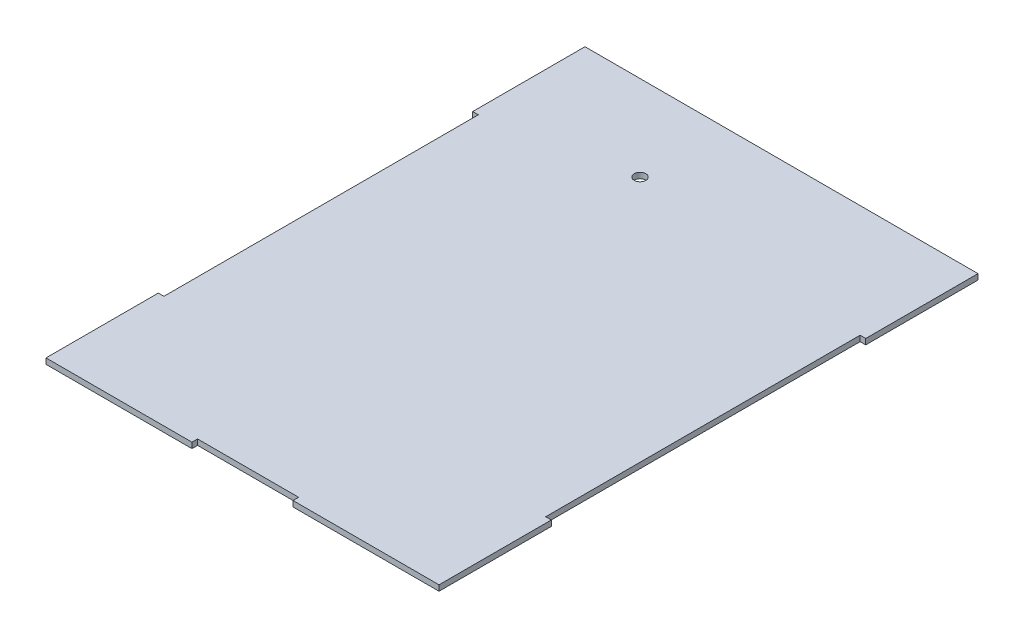
from build123d import *

# Parameters (mm, degrees)
SKETCH1_W                = 457.2
SKETCH1_H                = 609.6
BOSS_EXTRUDE1_DEPTH      = 6.35
CUT_EXTRUDE4_DEPTH       = 763.026457874
CUT_EXTRUDE4_DEPTH_BACK  = 763.026457874
SKETCH3_W                = 12.7
SKETCH3_H                = 355.6
CUT_EXTRUDE5_DEPTH       = 763.026457874
CUT_EXTRUDE5_DEPTH_BACK  = 763.026457874
CUT_EXTRUDE7_DEPTH       = 763.026457874
CUT_EXTRUDE7_DEPTH_BACK  = 763.026457874
SKETCH7_W                = 6.35
SKETCH7_H                = 127
CUT_EXTRUDE8_DEPTH       = 763.026457874
CUT_EXTRUDE8_DEPTH_BACK  = 763.026457874
CUT_EXTRUDE10_START      = -6.35
CUT_EXTRUDE10_OUTLINE_W  = 6.35
CUT_EXTRUDE10_OUTLINE_H  = 127
CUT_EXTRUDE10_DEPTH      = 6.35
CUT_EXTRUDE11_DEPTH      = 763.026457874
CUT_EXTRUDE11_DEPTH_BACK = 763.026457874
CUT_EXTRUDE12_DEPTH      = 759.233608461
CUT_EXTRUDE12_DEPTH_BACK = 759.233608461
SKETCH2_R                = 6.604
CUT_EXTRUDE13_DEPTH      = 759.233608461


# Read off the part's stored shape, not the designer's step: Cut-Extrude10
with BuildPart() as part:
    # Sketch1 → Boss-Extrude1 (new body)
    with BuildSketch(Plane(origin=(0, 0, 0), x_dir=(1, 0, 0), z_dir=(0, 1, 0))):
        with Locations((-228.6, 304.8)):
            Rectangle(SKETCH1_W, SKETCH1_H)
    extrude(amount=BOSS_EXTRUDE1_DEPTH)

    # Sketch3 → Cut-Extrude4 (cut, two sides: drawn at the far end of the back side and taken through both)
    with BuildSketch(Plane(origin=(0, 6.35, 0), x_dir=(1, 0, 0), z_dir=(0, 1, 0)).offset(-CUT_EXTRUDE4_DEPTH_BACK)):
        with Locations((-450.85, 304.8)):
            Rectangle(SKETCH3_W, SKETCH3_H)
    extrude(amount=CUT_EXTRUDE4_DEPTH + CUT_EXTRUDE4_DEPTH_BACK, mode=Mode.SUBTRACT)

    # Sketch5 → Cut-Extrude5 (cut, two sides: drawn at the far end of the back side and taken through both)
    with BuildSketch(Plane(origin=(0, 6.35, 0), x_dir=(1, 0, 0), z_dir=(0, 1, 0)).offset(-CUT_EXTRUDE5_DEPTH_BACK)):
        Polygon((1339.563236556, 482.6), (0, 482.6), (-12.7, 482.6), (-12.7, 127), (0, 127), (1339.563236556, 127), (4018.689709667, 127), (4018.689709667, 482.6), align=None)
    extrude(amount=CUT_EXTRUDE5_DEPTH + CUT_EXTRUDE5_DEPTH_BACK, mode=Mode.SUBTRACT)

    # Sketch7 → Cut-Extrude7 (cut, two sides: drawn at the far end of the back side and taken through both)
    with BuildSketch(Plane(origin=(0, 6.35, 0), x_dir=(1, 0, 0), z_dir=(0, 1, 0)).offset(-CUT_EXTRUDE7_DEPTH_BACK)):
        with Locations((-3.175, 63.5)):
            Rectangle(SKETCH7_W, SKETCH7_H)
    extrude(amount=CUT_EXTRUDE7_DEPTH + CUT_EXTRUDE7_DEPTH_BACK, mode=Mode.SUBTRACT)

    # Sketch8 → Cut-Extrude8 (cut, two sides: drawn at the far end of the back side and taken through both)
    with BuildSketch(Plane(origin=(0, 6.35, 0), x_dir=(1, 0, 0), z_dir=(0, 1, 0)).offset(-CUT_EXTRUDE8_DEPTH_BACK)):
        Polygon((-6.35, 2136.014036469), (-6.35, 609.6), (-6.35, 482.6), (-6.35, -1043.814036469), (3046.478072938, -1043.814036469), (3046.478072938, 2136.014036469), align=None)
    extrude(amount=CUT_EXTRUDE8_DEPTH + CUT_EXTRUDE8_DEPTH_BACK, mode=Mode.SUBTRACT)

    # Cut-Extrude10 outline → Cut-Extrude10 (cut)
    with BuildSketch(Plane(origin=(0, 6.35, 0), x_dir=(1, 0, 0), z_dir=(0, 1, 0)).offset(CUT_EXTRUDE10_START)):
        with Locations((-454.025, 546.1)):
            Rectangle(CUT_EXTRUDE10_OUTLINE_W, CUT_EXTRUDE10_OUTLINE_H)
    extrude(amount=CUT_EXTRUDE10_DEPTH, mode=Mode.SUBTRACT)

    # Sketch11 → Cut-Extrude11 (cut, two sides: drawn at the far end of the back side and taken through both)
    with BuildSketch(Plane(origin=(0, 6.35, 0), x_dir=(1, 0, 0), z_dir=(0, 1, 0)).offset(-CUT_EXTRUDE11_DEPTH_BACK)):
        Polygon((-450.85, 1645.896828812), (-450.85, 127), (-450.85, 0), (-450.85, -1518.896828812), (-3488.643657625, -1518.896828812), (-3488.643657625, 1645.896828812), align=None)
    extrude(amount=CUT_EXTRUDE11_DEPTH + CUT_EXTRUDE11_DEPTH_BACK, mode=Mode.SUBTRACT)

    # Sketch6 → Cut-Extrude12 (cut, two sides: drawn at the far end of the back side and taken through both)
    with BuildSketch(Plane(origin=(0, 6.35, 0), x_dir=(1, 0, 0), z_dir=(0, 1, 0)).offset(-CUT_EXTRUDE12_DEPTH_BACK)):
        Polygon((-171.45, -1351.158484296), (-171.45, 0), (-171.45, 6.35), (-285.75, 6.35), (-285.75, 0), (-285.75, -1351.158484296), (-285.75, -4053.475452889), (-171.45, -4053.475452889), align=None)
    extrude(amount=CUT_EXTRUDE12_DEPTH + CUT_EXTRUDE12_DEPTH_BACK, mode=Mode.SUBTRACT)

    # Sketch2 → Cut-Extrude13 (cut, through all)
    with BuildSketch(Plane(origin=(0, 6.35, 0), x_dir=(1, 0, 0), z_dir=(0, 1, 0))):
        with Locations(Location((-292.1, 513.08, 0), (0, 0, 270))):
            Circle(SKETCH2_R)
    extrude(amount=-CUT_EXTRUDE13_DEPTH, mode=Mode.SUBTRACT)


solid = part.part
